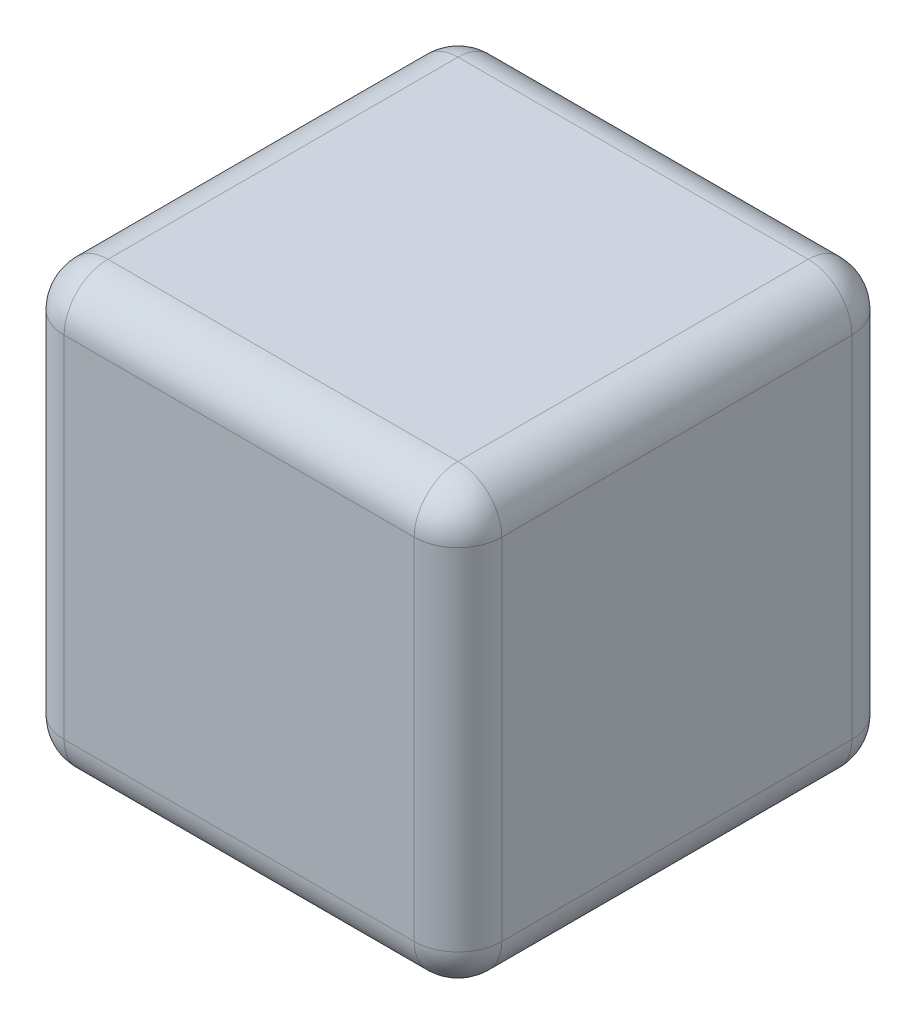
from build123d import *

# Parameters (mm, degrees)
SKETCH1_W           = 5
SKETCH1_H           = 5
BOSS_EXTRUDE1_DEPTH = 5
FILLET1_R           = 0.5


with BuildPart() as part:
    # Sketch1 → Boss-Extrude1 (new body)
    with BuildSketch(Plane(origin=(0, 0, 0), x_dir=(1, 0, 0), z_dir=(0, 1, 0))):
        Rectangle(SKETCH1_W, SKETCH1_H)
    extrude(amount=BOSS_EXTRUDE1_DEPTH)

    # Fillet1
    fillet1_edges = [part.edges().sort_by_distance(p)[0] for p in [
        (2.5, 2.5, -2.5),
        (-2.5, 2.5, -2.5),
        (0, 0, -2.5),
        (-2.5, 0, 0),
        (-2.5, 2.5, 2.5),
        (-2.5, 5, 0),
        (0, 5, -2.5),
        (2.5, 0, 0),
        (0, 0, 2.5),
        (2.5, 2.5, 2.5),
        (2.5, 5, 0),
        (0, 5, 2.5),
    ]]
    fillet(fillet1_edges, radius=FILLET1_R)


solid = part.part
